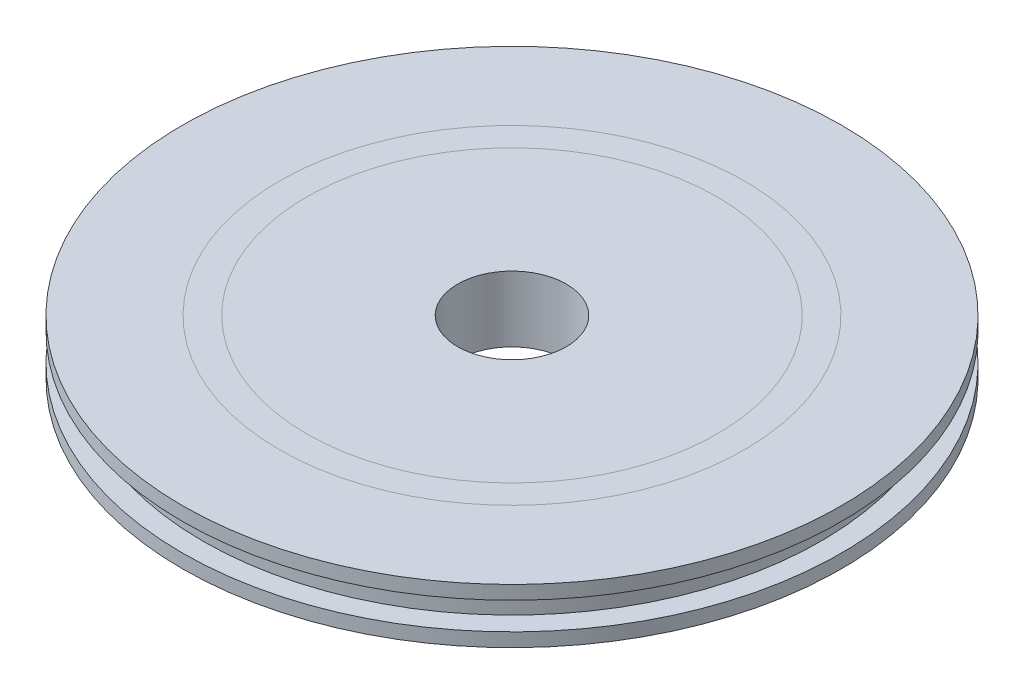
from build123d import *

# Parameters (mm, degrees)
SKETCH6_R           = 5.0419
CUT_EXTRUDE1_DEPTH  = 44.553374001
BOSS_EXTRUDE1_START = 1.016
SKETCH7_R           = 22.86
SKETCH7_R_2         = 5.0419
BOSS_EXTRUDE1_DEPTH = 1.016


with BuildPart() as part:
    # Sketch1 → Revolve1 (revolve)
    with BuildSketch(Plane(origin=(0, 0, 0), x_dir=(0, 0, -1), z_dir=(1, 0, 0))):
        Polygon((0, 0), (0, -5.08), (-30.58668, -5.08), (-30.58668, -3.81), (-28.68168, -3.81), (-28.68168, -1.27), (-30.58668, -1.27), (-30.58668, 0), align=None)
    revolve(axis=Axis((0, 0, 0), (0, -1, 0)))

    # Sketch6 → Cut-Extrude1 (cut, through all)
    with BuildSketch(Plane.XZ.offset(5.08)):
        Circle(SKETCH6_R)
    extrude(amount=-CUT_EXTRUDE1_DEPTH, mode=Mode.SUBTRACT)

    # Sketch7 → Boss-Extrude1 (add)
    with BuildSketch(Plane.XZ.offset(5.08).offset(BOSS_EXTRUDE1_START)):
        Circle(SKETCH7_R)
        Circle(SKETCH7_R_2, mode=Mode.SUBTRACT)
    extrude(amount=-BOSS_EXTRUDE1_DEPTH)


solid = part.part
